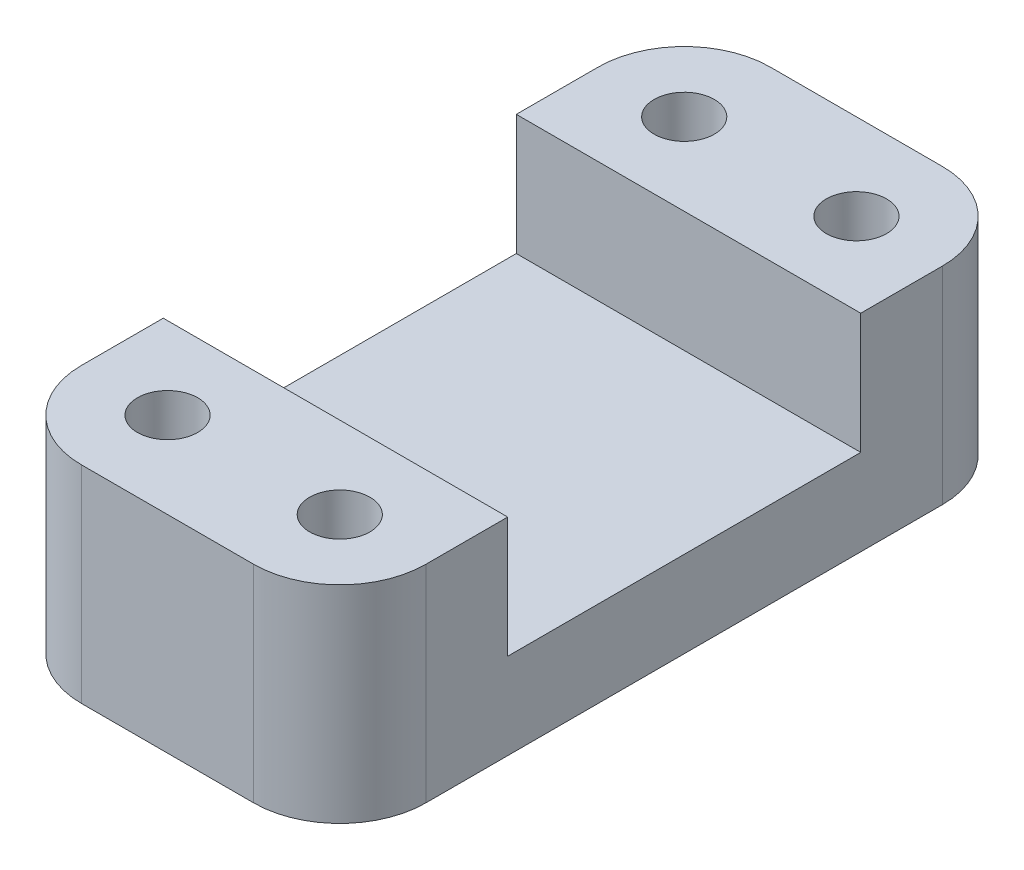
from build123d import *

# Parameters (mm, degrees)
SKETCH1_W                                           = 20
SKETCH1_H                                           = 40
BOSS_EXTRUDE1_DEPTH                                 = 5
SKETCH2_W                                           = 20
SKETCH2_H                                           = 9.75
BOSS_EXTRUDE2_DEPTH                                 = 7
SKETCH3_R                                           = 1.75
CUT_EXTRUDE1_DEPTH                                  = 26.377155081
CBORE_FOR_M3_HEX_SOCKET_HEAD_CAP_SCREW1_D           = 3.4
CBORE_FOR_M3_HEX_SOCKET_HEAD_CAP_SCREW1_CBORE_D     = 6.5
CBORE_FOR_M3_HEX_SOCKET_HEAD_CAP_SCREW1_CBORE_DEPTH = 3.4
FILLET1_R                                           = 5


with BuildPart() as part:
    # Sketch1 → Boss-Extrude1 (new body)
    with BuildSketch(Plane(origin=(0, 0, 0), x_dir=(1, 0, 0), z_dir=(0, 1, 0))):
        Rectangle(SKETCH1_W, SKETCH1_H)
    extrude(amount=BOSS_EXTRUDE1_DEPTH)

    # Sketch2 → Boss-Extrude2 (add)
    with BuildSketch(Plane(origin=(0, 5, 0), x_dir=(1, 0, 0), z_dir=(0, 1, 0))):
        with Locations((0, -15.125)):
            Rectangle(SKETCH2_W, SKETCH2_H)
        with Locations((0, 15.125)):
            Rectangle(SKETCH2_W, SKETCH2_H)
    extrude(amount=BOSS_EXTRUDE2_DEPTH)

    # Sketch3 → Cut-Extrude1 (cut, through all)
    with BuildSketch(Plane.XZ):
        with Locations((5, 15)):
            Circle(SKETCH3_R)
        with Locations((-5, 15)):
            Circle(SKETCH3_R)
        with Locations((-5, -15)):
            Circle(SKETCH3_R)
        with Locations((5, -15)):
            Circle(SKETCH3_R)
    extrude(amount=-CUT_EXTRUDE1_DEPTH, mode=Mode.SUBTRACT)

    # CBORE for M3 Hex Socket Head Cap Screw1 (through all)
    with Locations(Plane(origin=(0, 0, 0), x_dir=(-1, 0, 0), z_dir=(0, -1, 0))):
        with Locations((-5, -15), (5, -15), (5, 15), (-5, 15)):
            CounterBoreHole(CBORE_FOR_M3_HEX_SOCKET_HEAD_CAP_SCREW1_D / 2, CBORE_FOR_M3_HEX_SOCKET_HEAD_CAP_SCREW1_CBORE_D / 2, CBORE_FOR_M3_HEX_SOCKET_HEAD_CAP_SCREW1_CBORE_DEPTH)

    # Fillet1
    fillet1_edges = [part.edges().sort_by_distance(p)[0] for p in [
        (10, 6, -20),
        (-10, 6, -20),
        (-10, 6, 20),
        (10, 6, 20),
    ]]
    fillet(fillet1_edges, radius=FILLET1_R)


solid = part.part
